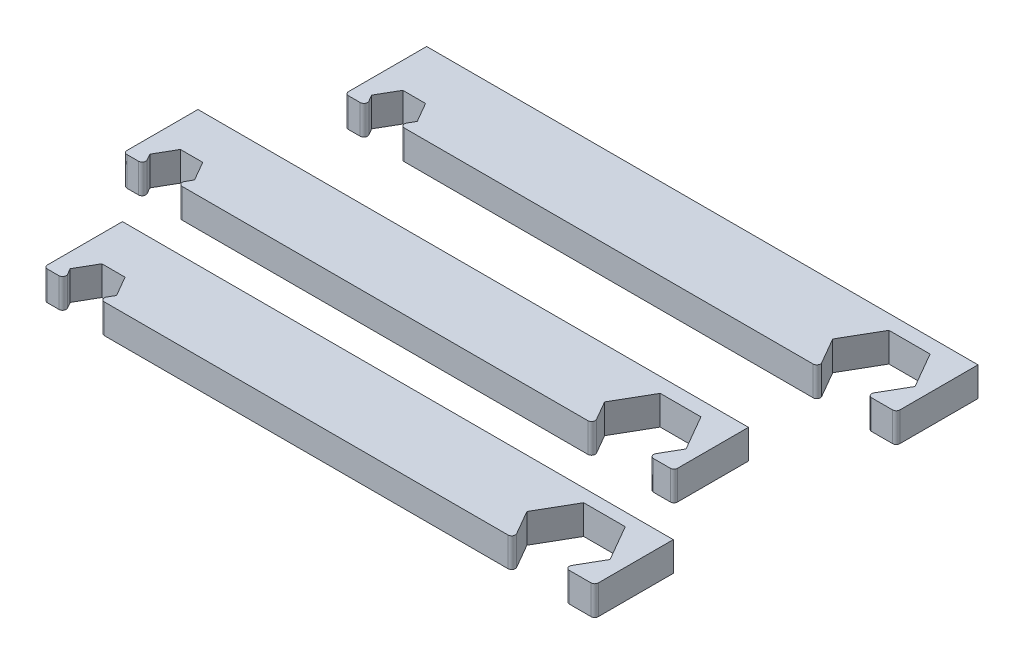
from build123d import *

# Parameters (mm, degrees)
BOSS_EXTRUDE1_DEPTH   = 4
BOSS_EXTRUDE1_2_DEPTH = 4
BOSS_EXTRUDE1_3_DEPTH = 4
FILLET2_R             = 0.5
FILLET4_R             = 0.5
FILLET5_R             = 0.5


with BuildPart() as part:
    # Sketch1 → Boss-Extrude1 (new body)
    with BuildSketch(Plane(origin=(0, 0, 0), x_dir=(1, 0, 0), z_dir=(0, 1, 0))):
        Polygon((-77.301456168, 10.855228753), (-78.224260095, 9.256885466), (-21.289274553, 9.256885466), (-23.640616526, 13.329529228), (-20.79716645, 18.254529228), (-15.110266298, 18.254529228), (-12.266816223, 13.329529228), (-14.618158195, 9.256885466), (-10.295859429, 9.256885466), (-10.295859429, 20.00971138), (-85.65230913, 20.00971138), (-85.65230913, 9.256885466), (-82.729505203, 9.256885466), (-83.65230913, 10.855228753), (-82.064595889, 13.605228753), (-78.889169409, 13.605228753), align=None)
    extrude(amount=BOSS_EXTRUDE1_DEPTH)

    # Fillet5
    fillet5_edges = [part.edges().sort_by_distance(p)[0] for p in [
        (-10.295859429, 2, -9.256885466),
        (-14.618158195, 2, -9.256885466),
        (-21.289274553, 2, -9.256885466),
        (-78.224260095, 2, -9.256885466),
        (-82.729505203, 2, -9.256885466),
        (-85.65230913, 2, -9.256885466),
    ]]
    fillet(fillet5_edges, radius=FILLET5_R)


with BuildPart() as body_2:
    # Sketch1 → Boss-Extrude1 2 (new body)
    with BuildSketch(Plane(origin=(0, 0, 0), x_dir=(1, 0, 0), z_dir=(0, 1, 0))):
        Polygon((-20.165154289, 31.62361492), (-22.105408646, 28.262995795), (-18.459485289, 28.262995795), (-18.459485289, 38.458524036), (-93.772221983, 38.458524036), (-93.772221983, 28.262995795), (-90.842508941, 28.262995795), (-91.772221983, 29.873306019), (-90.24224377, 32.523306019), (-87.182287343, 32.523306019), (-85.65230913, 29.873306019), (-86.582022171, 28.262995795), (-29.367760128, 28.262995795), (-31.308014485, 31.62361492), (-28.522299436, 36.44861492), (-22.950869338, 36.44861492), align=None)
    extrude(amount=BOSS_EXTRUDE1_2_DEPTH)

    # Fillet4
    fillet4_edges = [body_2.edges().sort_by_distance(p)[0] for p in [
        (-18.459485289, 2, -28.262995795),
        (-22.105408646, 2, -28.262995795),
        (-29.367760128, 2, -28.262995795),
        (-86.582022171, 2, -28.262995795),
        (-90.842508941, 2, -28.262995795),
        (-93.772221983, 2, -28.262995795),
    ]]
    fillet(fillet4_edges, radius=FILLET4_R)


with BuildPart() as body_3:
    # Sketch1 → Boss-Extrude1 3 (new body)
    with BuildSketch(Plane(origin=(0, 0, 0), x_dir=(1, 0, 0), z_dir=(0, 1, 0))):
        Polygon((-78.316043793, 50.379744764), (-20.673061742, 50.379744764), (-23.159410422, 54.686227003), (-20.34482786, 59.561227003), (-14.715662735, 59.561227003), (-11.901080173, 54.686227003), (-14.387428853, 50.379744764), (-10.163067183, 50.379744764), (-10.163067183, 61.564318529), (-85.592373411, 61.564318529), (-85.592373411, 50.379744764), (-82.633320121, 50.379744764), (-83.592373411, 52.040873788), (-82.033527684, 54.740873788), (-78.91583623, 54.740873788), (-77.356990503, 52.040873788), align=None)
    extrude(amount=BOSS_EXTRUDE1_3_DEPTH)

    # Fillet2
    fillet2_edges = [body_3.edges().sort_by_distance(p)[0] for p in [
        (-85.592373411, 2, -50.379744764),
        (-78.316043793, 2, -50.379744764),
        (-82.633320121, 2, -50.379744764),
        (-10.163067183, 2, -50.379744764),
        (-20.673061742, 2, -50.379744764),
        (-14.387428853, 2, -50.379744764),
    ]]
    fillet(fillet2_edges, radius=FILLET2_R)


solid = Compound([part.part, body_2.part, body_3.part])
